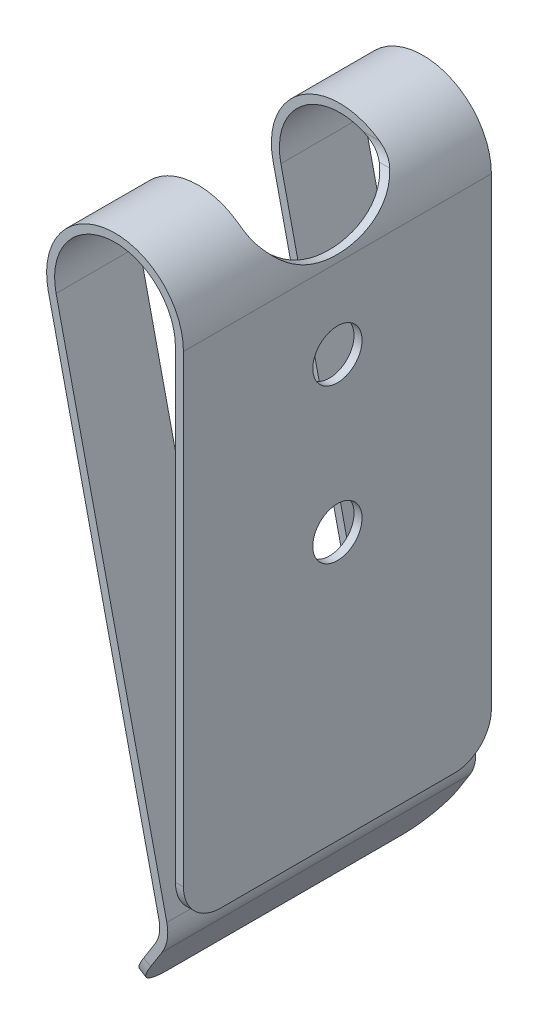
from build123d import *

# Parameters (mm, degrees)
EXTRUDE_THIN1_DEPTH              = 25
CUT_EXTRUDE1_REACH               = 41.464
CUT_EXTRUDE1_OFFSET_FROM_SURFACE = 2
CUT_EXTRUDE2_DEPTH               = 39.114790536728684
CUT_EXTRUDE2_DEPTH_BACK          = 39.114790536728684
FILLET1_R                        = 2
FILLET2_R                        = 3
SKETCH4_R                        = 1.9999999999999996
CUT_EXTRUDE3_DEPTH               = 39.11479062976518


with BuildPart() as part:
    # Sketch1 → Extrude-Thin1 (new body)
    with BuildSketch(Plane.XY):
        with BuildLine():
            Line((-3.622105329640586, -26.801338649985606), (-1.0941188006005313, -22.79472249406353))
            ThreePointArc((-1.0941188006005313, -22.79472249406353), (-0.66792233314523, -21.684442737284584), (-0.6990538082442912, -20.49557966760723))
            Line((-0.6990538082442912, -20.49557966760723), (-9.68971050504969, 19.237405741595826))
            ThreePointArc((-9.68971050504969, 19.237405741595826), (-5.449997394886004, 25.195000000000007), (0, 20.320000000000004))
            Line((0, 20.320000000000004), (0, -20.320000000000004))
            Line((0, -20.320000000000004), (0.65, -20.320000000000004))
            Line((0.65, -20.320000000000004), (0.65, 20.320000000000004))
            ThreePointArc((0.6499999999999986, 20.320000000000004), (-5.52217034544628, 25.840980700336655), (-10.323683013380226, 19.093952408831854))
            Line((-10.323683013380226, 19.093952408831854), (-1.3330263165748255, -20.639033000371203))
            ThreePointArc((-1.3330263165748275, -20.639033000371192), (-1.3085337715329808, -21.57436555978272), (-1.6438418847081215, -22.4478730587184))
            Line((-1.6438418847081135, -22.447873058718383), (-4.171828413748168, -26.454489214640457))
            Line((-4.171828413748168, -26.454489214640457), (-3.622105329640586, -26.801338649985606))
        make_face()
    extrude(amount=EXTRUDE_THIN1_DEPTH)

    # Cut-Extrude1: up to this face of the body (flat: up to its plane, moved by the offset)
    cut_extrude1_end = Plane(part.part.faces().sort_by_distance((0, 0, 12.5))[0]).offset(CUT_EXTRUDE1_OFFSET_FROM_SURFACE)
    # Sketch2 → Cut-Extrude1 (cut, up to the picked face)
    with BuildSketch(Plane(origin=(-5.7107644938092665, -1.2922140763239114, 0), x_dir=(0, 0, 1), z_dir=(-0.9753423205085142, -0.22069743502149478, 0)), mode=Mode.PRIVATE) as cut_extrude1_sk1:
        with BuildLine():
            Line((18.249999999999996, 28.456882519592593), (18.25, -5.793117480407402))
            ThreePointArc((18.25, -5.793117480407402), (12.499999999999998, -11.5431174804074), (6.750000000000001, -5.793117480407404))
            Line((6.750000000000001, -5.793117480407404), (6.749999999999996, 28.456882519592593))
            ThreePointArc((6.749999999999996, 28.456882519592593), (12.499999999999995, 34.2068825195926), (18.249999999999996, 28.456882519592593))
        make_face()
    cut_extrude1_tool1 = split(extrude(cut_extrude1_sk1.sketch, amount=-CUT_EXTRUDE1_REACH, mode=Mode.PRIVATE), bisect_by=cut_extrude1_end, keep=Keep.BOTH, mode=Mode.PRIVATE)
    add(cut_extrude1_tool1.solids().sort_by(Axis((-8.211682, 9.760251, 12.5), (0.9753423205085142, 0.22069743502149478, 0)))[0], mode=Mode.SUBTRACT)

    # Sketch3 → Cut-Extrude2 (cut, two sides: drawn at the far end of the back side and taken through both)
    with BuildSketch(Plane.ZY.offset(-CUT_EXTRUDE2_DEPTH_BACK)):
        with BuildLine():
            Line((18.249999999999993, 24.27238272866149), (18.249999999999996, 25.05505662424576))
            Line((18.249999999999996, 25.05505662424576), (6.749999999999996, 25.05505662424576))
            Line((6.749999999999996, 25.05505662424576), (6.749999999999999, 24.27238272866149))
            ThreePointArc((6.749999999999999, 24.27238272866149), (12.499999999999995, 20.875332308455405), (18.249999999999993, 24.27238272866149))
        make_face()
    extrude(amount=CUT_EXTRUDE2_DEPTH + CUT_EXTRUDE2_DEPTH_BACK, mode=Mode.SUBTRACT)

    # Fillet1
    # the kernel refuses this fillet: 2 mm, written as the material it adds along each edge
    with BuildSketch(Plane(origin=(0.6919383663248766, 24.272382728661498, 18.25), x_dir=(0, -0.8498127825413853, -0.5270846560366448), z_dir=(-1, 0, 0))) as fillet1_piece_1_section:
        with BuildLine():
            CenterArc((0.5741727604103483, -1.997336805169661), FILLET1_R, 87.04285714004924, 34.765830441625596)
            Line((-0.47999655166291116, -0.29771124008687166), (0, 0))
            ThreePointArc((0, 0), (0.3386753487804471, 0.00874177622603999), (0.6773506975608955, 0))
        make_face()
    fillet1_piece_1 = extrude(amount=4.385315110227097, mode=Mode.PRIVATE)
    fillet1_piece_1 = fillet1_piece_1 & Plane(origin=(-4.905332308455408, 20.320000000000007, 18.185221139731127), x_dir=(1, -6.4e-16, 0), z_dir=(0, 0, -1)) * Cylinder(5.555332308455408, 12, mode=Mode.PRIVATE)
    fillet1_piece_1 = fillet1_piece_1 - Plane(origin=(-4.90533230845541, 20.320000000000007, 18.185221139731127), x_dir=(-0.9753423205085139, -0.220697435021496, 0), z_dir=(0, 0, -1)) * Cylinder(4.9053323084554075, 12, mode=Mode.PRIVATE)
    add(fillet1_piece_1)
    with BuildSketch(Plane(origin=(-3.6933767439022205, 24.272382728661498, 6.7499999999999964), x_dir=(0, 1, 0), z_dir=(1, 0, 0))) as fillet1_piece_2_section:
        with BuildLine():
            CenterArc((0.5648262317583601, 2), FILLET1_R, 235.23416955837342, 34.765830441626576)
            ThreePointArc((-0.5756212810506085, 0.35702115944001456), (-0.2924182966405411, 0.17108170654102572), (0, 0))
            Line((0, 0), (0.5648262317583601, 0))
        make_face()
    fillet1_piece_2 = extrude(amount=4.385315110227104, mode=Mode.PRIVATE)
    fillet1_piece_2 = fillet1_piece_2 - Plane(origin=(-4.90533230845541, 20.320000000000007, 6.814778786528934), x_dir=(-0.9753423205085139, -0.220697435021496, 0), z_dir=(0, 0, -1)) * Cylinder(4.9053323084554075, 12, mode=Mode.PRIVATE)
    fillet1_piece_2 = fillet1_piece_2 & Plane(origin=(-4.905332308455408, 20.320000000000007, 6.814778786528934), x_dir=(1, -6.4e-16, 0), z_dir=(0, 0, -1)) * Cylinder(5.555332308455408, 12, mode=Mode.PRIVATE)
    add(fillet1_piece_2)

    # Fillet2
    fillet2_edges = [part.edges().sort_by_distance(p)[0] for p in [
        (0.325, -20.320000000000004, 0),
        (-3.896966871694377, -26.62791393231303, 0),
        (0.325, -20.320000000000004, 25),
        (-3.896966871694377, -26.62791393231303, 25),
    ]]
    fillet(fillet2_edges, radius=FILLET2_R)

    # Sketch4 → Cut-Extrude3 (cut, through all)
    with BuildSketch(Plane.ZY):
        with Locations(Location((12.5, 13.875332308455407, 0), (0, 0, 270))):
            Circle(SKETCH4_R)
        with Locations(Location((12.5, 1.375332308455407, 0), (0, 0, 270))):
            Circle(SKETCH4_R)
    extrude(amount=-CUT_EXTRUDE3_DEPTH, mode=Mode.SUBTRACT)


solid = part.part
